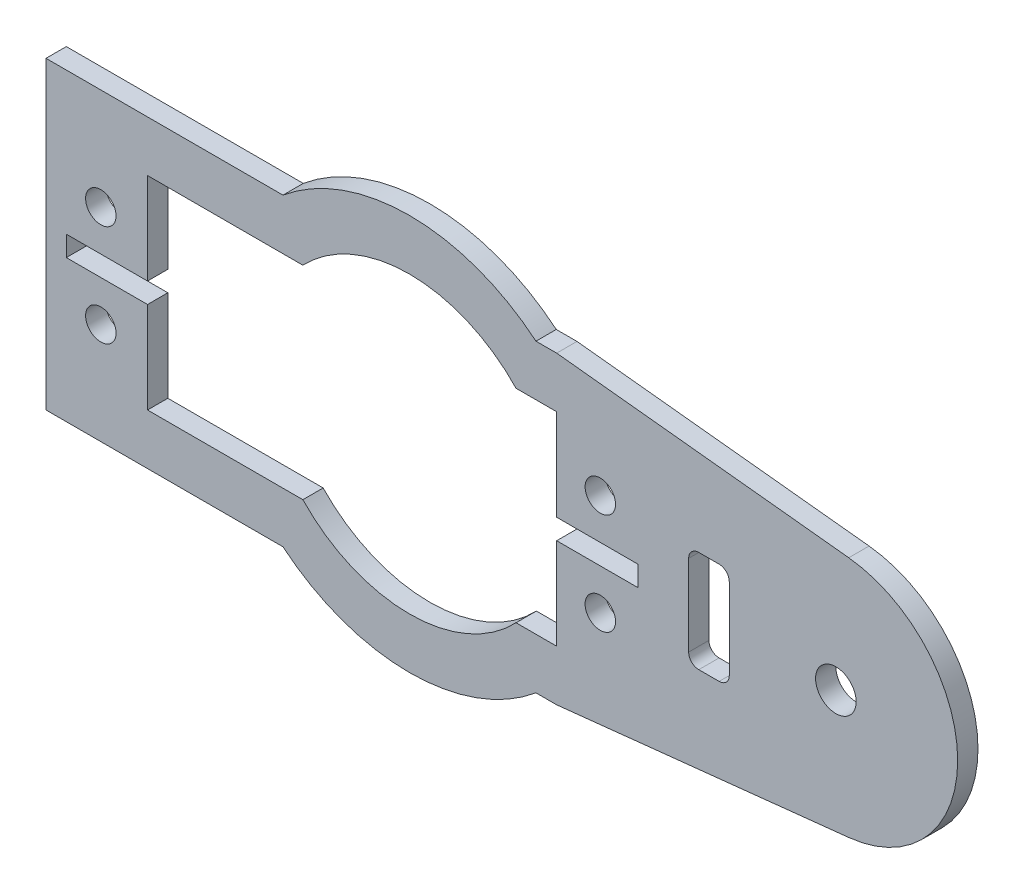
from build123d import *

# Parameters (mm, degrees)
SKETCH1_R      = 2
EXTRUDE1_DEPTH = 2
SKETCH2_R      = 1.5
EXTRUDE2_DEPTH = 2
EXTRUDE3_DEPTH = 2
EXTRUDE4_DEPTH = 2
SKETCH5_R      = 14.5
EXTRUDE5_DEPTH = 2


with BuildPart() as part:
    # Sketch1 → Extrude1 (new body)
    with BuildSketch(Plane.XY):
        with BuildLine():
            Line((1.27220287, -11.932371929), (-27.5, -15))
            Line((-27.5, -15), (-29.540064206, -15))
            ThreePointArc((-29.540064206, -15), (-42, -19.5), (-54.459935794, -15))
            Line((-54.459935794, -15), (-77.8, -15))
            Line((-77.8, -15), (-77.8, 15))
            Line((-77.8, 15), (-54.459935794, 15))
            ThreePointArc((-54.459935794, 15), (-42, 19.5), (-29.540064206, 15))
            Line((-29.540064206, 15), (-27.5, 15))
            Line((-27.5, 15), (1.27220287, 11.932371929))
            ThreePointArc((1.27220287, 11.932371929), (12, 0), (1.27220287, -11.932371929))
        make_face()
        Circle(SKETCH1_R, mode=Mode.SUBTRACT)
    extrude(amount=EXTRUDE1_DEPTH)

    # Sketch2 → Extrude2 (cut)
    with BuildSketch(Plane.XY.offset(2)):
        with Locations((-23.2, 5)):
            Circle(SKETCH2_R)
        with Locations((-72.4, 5)):
            Circle(SKETCH2_R)
        with Locations((-23.2, -5)):
            Circle(SKETCH2_R)
        with Locations((-72.4, -5)):
            Circle(SKETCH2_R)
    extrude(amount=-EXTRUDE2_DEPTH, mode=Mode.SUBTRACT)

    # Sketch3 → Extrude3 (cut)
    with BuildSketch(Plane.XY.offset(2)):
        with BuildLine():
            Line((-13.5, 5), (-11.5, 5))
            ThreePointArc((-11.5, 5), (-10.792893219, 4.707106781), (-10.5, 4))
            Line((-10.5, 4), (-10.5, -4))
            ThreePointArc((-10.5, -4), (-10.792893219, -4.707106781), (-11.5, -5))
            Line((-11.5, -5), (-13.5, -5))
            ThreePointArc((-13.5, -5), (-14.207106781, -4.707106781), (-14.5, -4))
            Line((-14.5, -4), (-14.5, 4))
            ThreePointArc((-14.5, 4), (-14.207106781, 4.707106781), (-13.5, 5))
        make_face()
    extrude(amount=-EXTRUDE3_DEPTH, mode=Mode.SUBTRACT)

    # Sketch4 → Extrude4 (cut)
    with BuildSketch(Plane.XY.offset(2)):
        Polygon((-27.5, -1), (-27.5, -10), (-67.8, -10), (-67.8, -1), (-75.8, -1), (-75.8, 1), (-67.8, 1), (-67.8, 10), (-27.5, 10), (-27.5, 1), (-19.5, 1), (-19.5, -1), align=None)
    extrude(amount=-EXTRUDE4_DEPTH, mode=Mode.SUBTRACT)

    # Sketch5 → Extrude5 (cut)
    with BuildSketch(Plane.XY.offset(2)):
        with Locations((-42, 0)):
            Circle(SKETCH5_R)
    extrude(amount=-EXTRUDE5_DEPTH, mode=Mode.SUBTRACT)


solid = part.part
